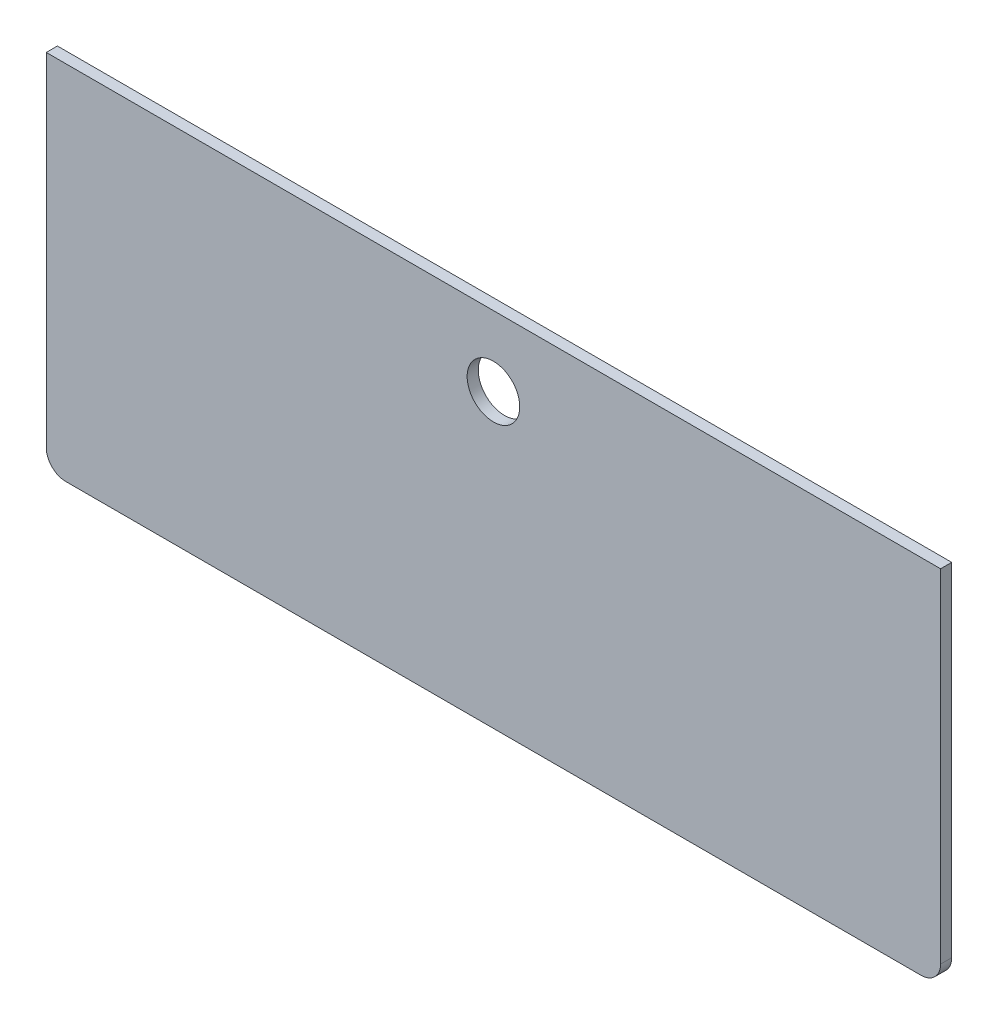
from build123d import *

# Parameters (mm, degrees)
SKETCH1_W           = 255
SKETCH1_H           = 103.175
SKETCH1_R           = 7.5
BOSS_EXTRUDE1_DEPTH = 3.175
FILLET1_R           = 5.55625


with BuildPart() as part:
    # Sketch1 → Boss-Extrude1 (new body)
    with BuildSketch(Plane.XY):
        with Locations((-24.265375854, -24.400711845)):
            Rectangle(SKETCH1_W, SKETCH1_H)
        with Locations((-24.265375854, 7.186788155)):
            Circle(SKETCH1_R, mode=Mode.SUBTRACT)
    extrude(amount=BOSS_EXTRUDE1_DEPTH)

    # Fillet1
    fillet1_edges = [part.edges().sort_by_distance(p)[0] for p in [
        (-151.765375854, -75.988211845, 1.5875),
        (103.234624146, -75.988211845, 1.5875),
    ]]
    fillet(fillet1_edges, radius=FILLET1_R)


solid = part.part
